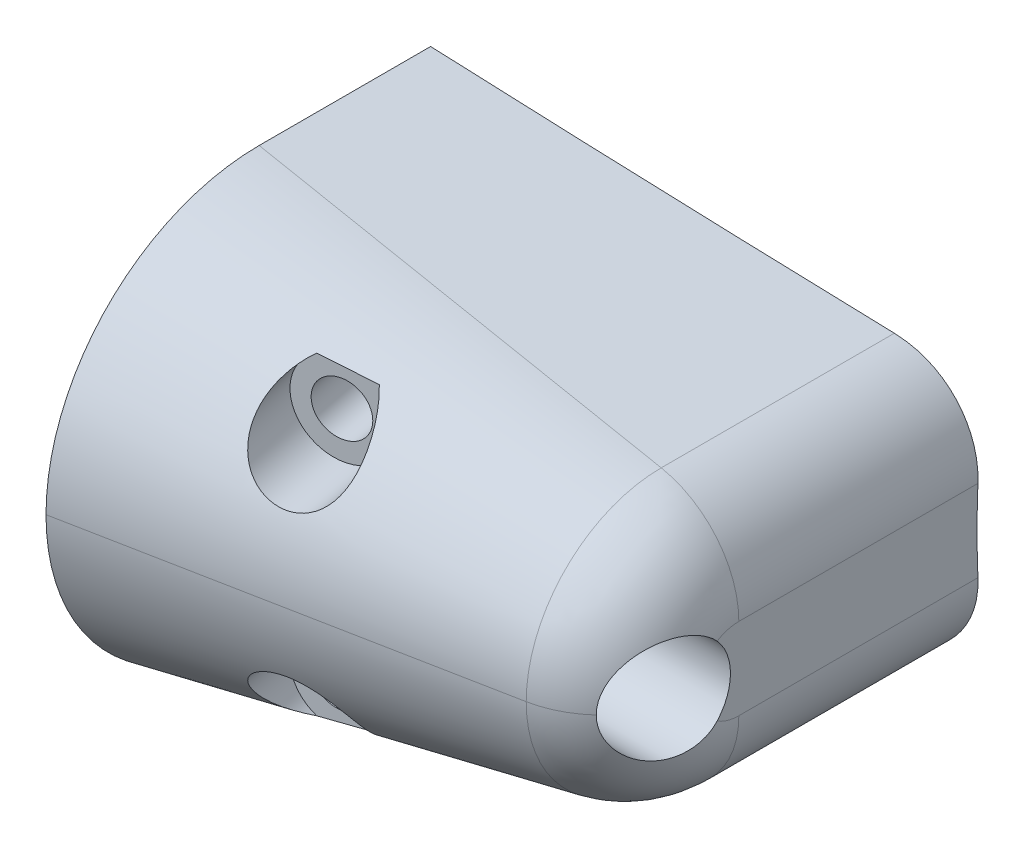
from build123d import *

# Parameters (mm, degrees)
ESQUISSE1_W                  = 20
ESQUISSE1_H                  = 18
BOSS_EXTRU_1_DEPTH           = 20
ENL_V_MAT_EXTRU_1_DEPTH      = 34.526109228
ENL_V_MAT_EXTRU_1_DEPTH_BACK = 34.526109228
ESQUISSE4_W                  = 23.372047651
ESQUISSE4_H                  = 17.8
ENL_V_MAT_EXTRU_3_DEPTH      = 1
CONG_2_R                     = 40
ESQUISSE5_R                  = 2.15
ENL_V_MAT_EXTRU_4_DEPTH      = 31.724582991
CONG_3_R                     = 9
CHANFREIN1_SIZE              = 20.578216064
CHANFREIN1_SIZE_2            = 4
CONG_4_R                     = 4
ESQUISSE6_R                  = 1.1
ENL_V_MAT_EXTRU_5_DEPTH      = 253.375332695
ESQUISSE10_R                 = 1.9
ENL_V_MAT_EXTRU_6_DEPTH      = 7.5


# Some blends are built 0.0001 mm under size
with BuildPart() as part:
    # Esquisse1 → Boss.-Extru.1 (new body)
    with BuildSketch(Plane.XY):
        with Locations((10, 3)):
            Rectangle(ESQUISSE1_W, ESQUISSE1_H)
    extrude(amount=BOSS_EXTRU_1_DEPTH)

    # Esquisse2 → Enlèv. mat.-Extru.1 (cut, two sides: drawn at the far end of the back side and taken through both)
    with BuildSketch(Plane(origin=(0, 12, 0), x_dir=(1, 0, 0), z_dir=(0, 1, 0)).offset(-ENL_V_MAT_EXTRU_1_DEPTH_BACK)):
        Polygon((85.451214086, 12.384445057), (20.045630921, -0.0408989), (0, -3.849042594), (0, 0), (0, 66.575366927), (71.310016401, 179.020907021), (156.761230487, 124.829985151), align=None)
    extrude(amount=ENL_V_MAT_EXTRU_1_DEPTH + ENL_V_MAT_EXTRU_1_DEPTH_BACK, mode=Mode.SUBTRACT)

    # Esquisse4 → Enlèv. mat.-Extru.3 (cut)
    with BuildSketch(Plane(origin=(0.705746644, 0, 3.714969257), x_dir=(-0.9824291803850712, 0, 0.1866357562952965), z_dir=(-0.1866357562952965, 0, -0.9824291803850712))):
        with Locations((-7.953308699, 3)):
            Rectangle(ESQUISSE4_W, ESQUISSE4_H)
    extrude(amount=-ENL_V_MAT_EXTRU_3_DEPTH, mode=Mode.SUBTRACT)

    # Congé2
    # the kernel refuses this fillet: 40 mm, written as the material it adds along each edge
    with BuildSketch(Plane(origin=(41.830053891, 11.9, -3.079684565), x_dir=(0, -1, 0), z_dir=(-0.9824291803850712, 0, 0.1866357562952965))) as cong_2_piece_1_section:
        with BuildLine():
            CenterArc((8.888194417, -40), CONG_2_R, 90, 12.838568141)
            Line((0, -1), (0, 0))
            Line((0, 0), (8.888194417, 0))
        make_face()
    cong_2_piece_1 = extrude(amount=64.798673587, mode=Mode.PRIVATE)
    cong_2_piece_1 = split(cong_2_piece_1, bisect_by=Plane(origin=(20, 11.9, -3.079684565), z_dir=(-1, 0, 0)), keep=Keep.TOP, mode=Mode.PRIVATE)
    cong_2_piece_1 = split(cong_2_piece_1, bisect_by=Plane(origin=(0, 11.9, -3.079684565), z_dir=(1, 0, 0)), keep=Keep.TOP, mode=Mode.PRIVATE)
    add(cong_2_piece_1)
    with BuildSketch(Plane(origin=(-21.830053891, -5.9, 9.014064887), x_dir=(-0.18663575629529652, 1.7763568394002434e-15, -0.9824291803850713), z_dir=(0.9824291803850712, 0, -0.1866357562952965))) as cong_2_piece_2_section:
        with BuildLine():
            CenterArc((40, 8.888194417), CONG_2_R, 180, 12.838568141)
            Line((0, 8.888194417), (0, 0))
            Line((0, 0), (1, 0))
        make_face()
    cong_2_piece_2 = extrude(amount=64.798673587, mode=Mode.PRIVATE)
    cong_2_piece_2 = split(cong_2_piece_2, bisect_by=Plane(origin=(20, -5.9, 9.014064887), z_dir=(-1, 0, 0)), keep=Keep.TOP, mode=Mode.PRIVATE)
    cong_2_piece_2 = split(cong_2_piece_2, bisect_by=Plane(origin=(0, -5.9, 9.014064887), z_dir=(1, 0, 0)), keep=Keep.TOP, mode=Mode.PRIVATE)
    add(cong_2_piece_2)

    # Esquisse5 → Enlèv. mat.-Extru.4 (cut, through all)
    with BuildSketch(Plane.ZY):
        with Locations((13.5, 3)):
            Circle(ESQUISSE5_R)
    extrude(amount=-ENL_V_MAT_EXTRU_4_DEPTH, mode=Mode.SUBTRACT)

    # Congé3
    cong_3_edges = [part.edges().sort_by_distance(p)[0] for p in [
        (10, 12, 20),
        (10, -6, 20),
    ]]
    fillet(cong_3_edges, radius=CONG_3_R - 0.0001)  # a hair under: the kernel refuses the full size

    # Chanfrein1
    # the kernel refuses this chamfer: 20.578216064, 4 mm, written as the material it takes off along each edge
    with BuildSketch(Plane(origin=(20, -6, -53.417428004), x_dir=(-1, 0, 0), z_dir=(0, 0, 1))) as chanfrein1_piece_1:
        Polygon((CHANFREIN1_SIZE, 0), (0, -CHANFREIN1_SIZE_2), (0, 0), align=None)
    extrude(amount=64.417528004, mode=Mode.SUBTRACT)
    with BuildSketch(Plane(origin=(20, 2.9999, 11.0001), x_dir=(0, -1, 0), z_dir=(0, 0, -1))) as chanfrein1_piece_2:
        Polygon((8.9999, CHANFREIN1_SIZE), (8.9999 - CHANFREIN1_SIZE_2, 0), (8.9999, 0), align=None)
    revolve(axis=Axis((20, 2.9999, 11.0001), (-1, 0, 0)), revolution_arc=90, mode=Mode.SUBTRACT)
    with BuildSketch(Plane(origin=(20, 3.0001, 11.0001), x_dir=(0, 0, 1), z_dir=(0, -1, 0))) as chanfrein1_piece_3:
        Polygon((8.9999, CHANFREIN1_SIZE), (8.9999 - CHANFREIN1_SIZE_2, 0), (8.9999, 0), align=None)
    revolve(axis=Axis((20, 3.0001, 11.0001), (-1, 0, 0)), revolution_arc=90, mode=Mode.SUBTRACT)
    with BuildSketch(Plane(origin=(20, 12, -53.417428004), x_dir=(-1, 0, 0), z_dir=(0, 0, 1))) as chanfrein1_piece_4:
        Polygon((CHANFREIN1_SIZE, 0), (0, CHANFREIN1_SIZE_2), (0, 0), align=None)
    extrude(amount=64.417528004, mode=Mode.SUBTRACT)
    with BuildSketch(Plane(origin=(20, 2.9999, 20), x_dir=(-1, 0, 0), z_dir=(0, 1, 0))) as chanfrein1_piece_5:
        Polygon((CHANFREIN1_SIZE, 0), (0, -CHANFREIN1_SIZE_2), (0, 0), align=None)
    extrude(amount=0.0002, mode=Mode.SUBTRACT)

    # Congé4
    # the kernel refuses this fillet: 4 mm, written as the material it takes off along each edge
    with BuildSketch(Plane(origin=(20, -2, -7.493740481), x_dir=(-0.9816271834478703, -0.19080899537548365, 0), z_dir=(0, 0, 1))) as cong_4_piece_1:
        with BuildLine():
            CenterArc((CONG_4_R * 0.824336385818, -CONG_4_R), CONG_4_R, 90, 79)
            Line((-CONG_4_R * 0.157290797629, -CONG_4_R * 0.809191004625), (0, 0))
            Line((0, 0), (CONG_4_R * 0.824336385818, 0))
        make_face()
    extrude(amount=18.493840481, mode=Mode.SUBTRACT)
    with BuildSketch(Plane(origin=(20, 2.9999, 11.0001), x_dir=(0, -1, 0), z_dir=(0, 0, -1))) as cong_4_piece_2:
        with BuildLine():
            CenterArc((4.9999 - CONG_4_R * 0.824336385818, CONG_4_R), CONG_4_R, 270, 79)
            Line((4.9999 - CONG_4_R * 0.824336385818, 0), (4.9999, 0))
            Line((4.9999, 0), (4.9999 + CONG_4_R * 0.157290797629, CONG_4_R * 0.809191004625))
        make_face()
    revolve(axis=Axis((20, 2.9999, 11.0001), (-1, 0, 0)), revolution_arc=90, mode=Mode.SUBTRACT)
    with BuildSketch(Plane(origin=(20, 3.0001, 11.0001), x_dir=(0, 0, 1), z_dir=(0, -1, 0))) as cong_4_piece_3:
        with BuildLine():
            CenterArc((4.9999 - CONG_4_R * 0.824336385818, CONG_4_R), CONG_4_R, 270, 79)
            Line((4.9999 - CONG_4_R * 0.824336385818, 0), (4.9999, 0))
            Line((4.9999, 0), (4.9999 + CONG_4_R * 0.157290797629, CONG_4_R * 0.809191004625))
        make_face()
    revolve(axis=Axis((20, 3.0001, 11.0001), (-1, 0, 0)), revolution_arc=90, mode=Mode.SUBTRACT)
    with BuildSketch(Plane(origin=(20, 8, -7.493740481), x_dir=(-0.9816271834478704, 0.19080899537548335, 0), z_dir=(0, 0, 1))) as cong_4_piece_4:
        with BuildLine():
            CenterArc((CONG_4_R * 0.824336385818, CONG_4_R), CONG_4_R, 191, 79)
            Line((-CONG_4_R * 0.157290797629, CONG_4_R * 0.809191004625), (0, 0))
            Line((0, 0), (CONG_4_R * 0.824336385818, 0))
        make_face()
    extrude(amount=18.493840481, mode=Mode.SUBTRACT)
    with BuildSketch(Plane(origin=(20, 2.9999, 16), x_dir=(-0.9816271834478704, 0, 0.19080899537548315), z_dir=(0, 1, 0))) as cong_4_piece_5:
        with BuildLine():
            CenterArc((CONG_4_R * 0.824336385818, -CONG_4_R), CONG_4_R, 90, 79)
            Line((-CONG_4_R * 0.157290797629, -CONG_4_R * 0.809191004625), (0, 0))
            Line((0, 0), (CONG_4_R * 0.824336385818, 0))
        make_face()
    extrude(amount=0.0002, mode=Mode.SUBTRACT)

    # Esquisse6 → Enlèv. mat.-Extru.5 (cut, through all)
    with BuildSketch(Plane(origin=(248.354172881, 0, -23.381298734), x_dir=(-0.9824291803850712, 0, 0.1866357562952965), z_dir=(-0.1866357562952965, 0, -0.9824291803850712))):
        with Locations(Location((244, 7.9, 0), (0, 0, 180))):
            Circle(ESQUISSE6_R)
        with Locations(Location((244, -1.9, 0), (0, 0, 180))):
            Circle(ESQUISSE6_R)
    extrude(amount=ENL_V_MAT_EXTRU_5_DEPTH, mode=Mode.SUBTRACT)

    # Esquisse10 → Enlèv. mat.-Extru.6 (cut)
    with BuildSketch(Plane(origin=(4.363786372, 0, 22.970470151), x_dir=(-0.9824291803850712, 0, 0.1866357562952965), z_dir=(-0.1866357562952965, 0, -0.9824291803850712))):
        with Locations((-4.4, 7.9)):
            Circle(ESQUISSE10_R)
        with Locations((-4.4, -1.9)):
            Circle(ESQUISSE10_R)
    extrude(amount=ENL_V_MAT_EXTRU_6_DEPTH, mode=Mode.SUBTRACT)


solid = part.part
